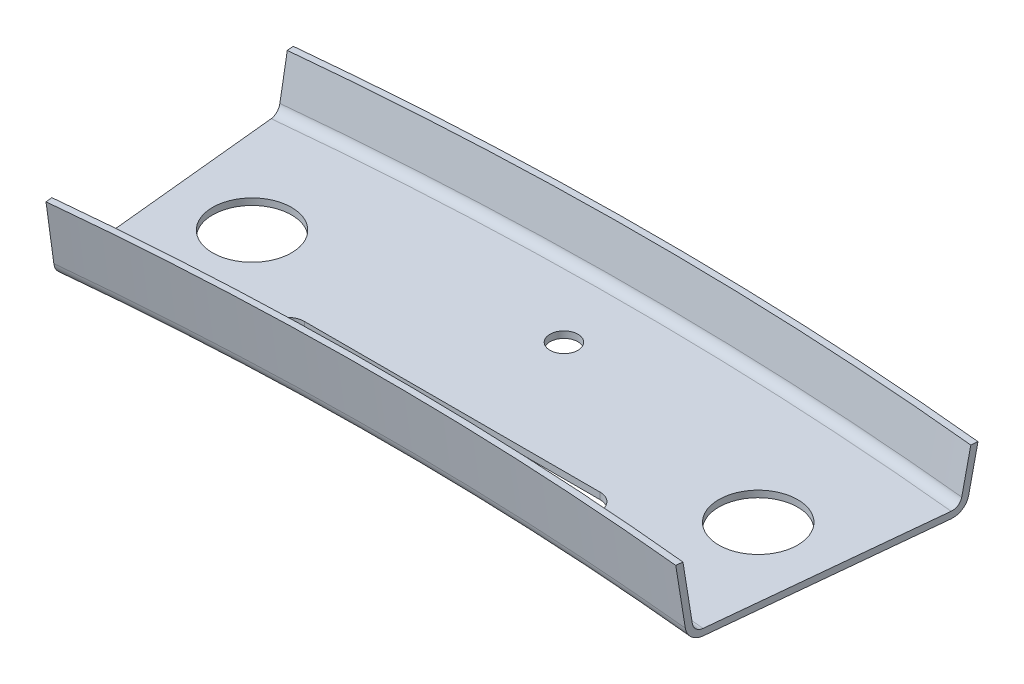
from build123d import *

# Parameters (mm, degrees)
MOUNTING_POINTS_DEPTH      = 116.971134903
MOUNTING_POINTS_DEPTH_BACK = 116.971134903
SKETCH3_R                  = 4.25
SKETCH3_R_2                = 12
SLOT_CLEARANCE_DEPTH       = 116.971134903
SLOT_CLEARANCE_DEPTH_BACK  = 116.971134903


with BuildPart() as part:
    # Sweep1: sweep along a path in Sketch1
    with BuildLine(Plane(origin=(0, 0, 0), x_dir=(1, 0, 0), z_dir=(0, 1, 0))) as sweep1_path:
        ThreePointArc((-100, -5), (0, 0), (100, -5))
    # Sketch2 → Sweep1 (sweep)
    with BuildSketch(Plane(origin=(0, 0, 0), x_dir=(0, 0, -1), z_dir=(1, 0, 0))):
        with BuildLine():
            Line((-34.478513015, 0), (34.478513015, 0))
            ThreePointArc((34.478513015, 0), (36.380479732, 0.679973576), (37.420255042, 2.411651595))
            Line((37.420255042, 2.411651595), (39.937924723, 15))
            Line((39.937924723, 15), (41.937924723, 15))
            Line((41.937924723, 15), (39.341808588, 2.019419324))
            ThreePointArc((39.341808588, 2.019419324), (37.608849737, -0.866710707), (34.438905209, -2))
            Line((34.438905209, -2), (-34.456138173, -2))
            ThreePointArc((-34.456138173, -2), (-37.71891986, -0.788701052), (-39.400819937, 2.258297735))
            Line((-39.400819937, 2.258297735), (-42.062075277, 20))
            Line((-42.062075277, 20), (-40.062075277, 20))
            Line((-40.062075277, 20), (-37.445322073, 2.554978641))
            ThreePointArc((-37.445322073, 2.554978641), (-36.436182027, 0.726779369), (-34.478513015, 0))
        make_face()
    sweep(path=sweep1_path.line)

    # Sketch3 → Mounting points (cut, two sides: drawn at the far end of the back side and taken through both)
    with BuildSketch(Plane(origin=(0, 0, 0), x_dir=(1, 0, 0), z_dir=(0, 1, 0)).offset(-MOUNTING_POINTS_DEPTH_BACK)):
        with Locations((0, 14.937924723)):
            Circle(SKETCH3_R)
        with Locations((-77, -2.961481483)):
            Circle(SKETCH3_R_2)
        with Locations((77, -2.961481483)):
            Circle(SKETCH3_R_2)
    extrude(amount=MOUNTING_POINTS_DEPTH + MOUNTING_POINTS_DEPTH_BACK, mode=Mode.SUBTRACT)

    # Sketch4 → Slot clearance (cut, two sides: drawn at the far end of the back side and taken through both)
    with BuildSketch(Plane(origin=(0, 0, 0), x_dir=(1, 0, 0), z_dir=(0, 1, 0)).offset(-SLOT_CLEARANCE_DEPTH_BACK)):
        with BuildLine():
            Line((-45, -19.062075277), (45, -19.062075277))
            ThreePointArc((45, -19.062075277), (50, -24.062075277), (45, -29.062075277))
            Line((45, -29.062075277), (-45, -29.062075277))
            ThreePointArc((-45, -29.062075277), (-50, -24.062075277), (-45, -19.062075277))
        make_face()
    extrude(amount=SLOT_CLEARANCE_DEPTH + SLOT_CLEARANCE_DEPTH_BACK, mode=Mode.SUBTRACT)


solid = part.part
